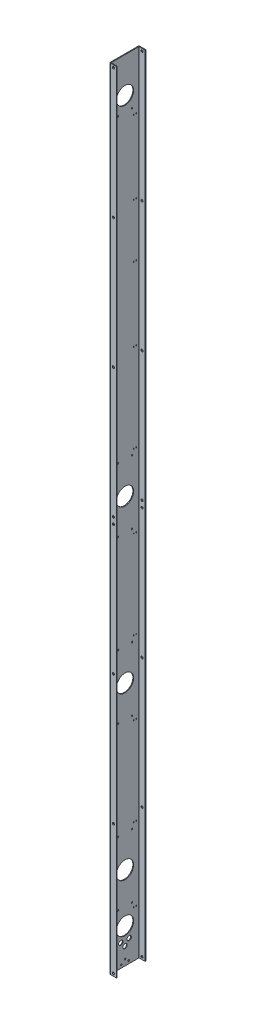
from build123d import *

# Parameters (mm, degrees)
BASE_FLANGE1_DEPTH = 3220
CUT_EXTRUDE1_REACH = 3222.656
SKETCH7_R          = 35
CUT_EXTRUDE3_REACH = 3222.656
SKETCH10_R         = 3
KHE_DAY_RUT_REACH  = 3222.656
SKETCH12_W         = 2
SKETCH12_H         = 5
LPATTERN2_COUNT    = 4
LPATTERN2_PITCH    = 660
LPATTERN3_COUNT    = 2
LPATTERN3_PITCH    = 2500
CUT_EXTRUDE6_REACH = 3229.542
SKETCH14_R         = 4.5
LPATTERN4_COUNT    = 4
LPATTERN4_PITCH    = 529
CUT_EXTRUDE7_REACH = 3222.681
SKETCH16_R         = 9
CUT_EXTRUDE8_REACH = 3222.656
SKETCH17_R         = 3
U_BOLT_REACH       = 3222.656
SKETCH18_R         = 3
LPATTERN6_COUNT    = 3
LPATTERN6_PITCH    = 660


# Sheet-metal steps are written as plain solids
with BuildPart() as part:
    # Sketch2 → Base-Flange1 (new body)
    with BuildSketch(Plane(origin=(0, 0, 0), x_dir=(1, 0, 0), z_dir=(0, 1, 0))):
        with BuildLine():
            Line((185, -57), (161, -57))
            ThreePointArc((161, -57), (160.292893219, -56.707106781), (160, -56))
            Line((160, -56), (160, 56))
            ThreePointArc((160, 56), (160.292893219, 56.707106781), (161, 57))
            Line((161, 57), (185, 57))
            Line((185, 57), (185, 60))
            Line((185, 60), (161, 60))
            ThreePointArc((161, 60), (158.171572875, 58.828427125), (157, 56))
            Line((157, 56), (157, -56))
            ThreePointArc((157, -56), (158.171572875, -58.828427125), (161, -60))
            Line((161, -60), (185, -60))
            Line((185, -60), (185, -57))
        make_face()
    extrude(amount=BASE_FLANGE1_DEPTH)

    # Sketch7 → Cut-Extrude1 (cut, up to next)
    with BuildSketch(Plane(origin=(160, 0, 0), x_dir=(0, 0, -1), z_dir=(1, 0, 0)), mode=Mode.PRIVATE) as cut_extrude1_sk1:
        with Locations((0, 340)):
            Circle(SKETCH7_R)
    cut_extrude1_tool1 = extrude(cut_extrude1_sk1.sketch, amount=-CUT_EXTRUDE1_REACH, mode=Mode.PRIVATE) & part.part
    # Sketch7 → Cut-Extrude1 (cut, up to next)
    with BuildSketch(Plane(origin=(160, 0, 0), x_dir=(0, 0, -1), z_dir=(1, 0, 0)), mode=Mode.PRIVATE) as cut_extrude1_sk2:
        with Locations((0, 1000)):
            Circle(SKETCH7_R)
    cut_extrude1_tool2 = extrude(cut_extrude1_sk2.sketch, amount=-CUT_EXTRUDE1_REACH, mode=Mode.PRIVATE) & part.part
    # Sketch7 → Cut-Extrude1 (cut, up to next)
    with BuildSketch(Plane(origin=(160, 0, 0), x_dir=(0, 0, -1), z_dir=(1, 0, 0)), mode=Mode.PRIVATE) as cut_extrude1_sk3:
        with Locations((0, 1660)):
            Circle(SKETCH7_R)
    cut_extrude1_tool3 = extrude(cut_extrude1_sk3.sketch, amount=-CUT_EXTRUDE1_REACH, mode=Mode.PRIVATE) & part.part
    # Sketch7 → Cut-Extrude1 (cut, up to next)
    with BuildSketch(Plane(origin=(160, 0, 0), x_dir=(0, 0, -1), z_dir=(1, 0, 0)), mode=Mode.PRIVATE) as cut_extrude1_sk4:
        with Locations((0, 3076)):
            Circle(SKETCH7_R)
    cut_extrude1_tool4 = extrude(cut_extrude1_sk4.sketch, amount=-CUT_EXTRUDE1_REACH, mode=Mode.PRIVATE) & part.part
    # Sketch7 → Cut-Extrude1 (cut, up to next)
    with BuildSketch(Plane(origin=(160, 0, 0), x_dir=(0, 0, -1), z_dir=(1, 0, 0)), mode=Mode.PRIVATE) as cut_extrude1_sk5:
        with Locations((0, 142)):
            Circle(SKETCH7_R)
    cut_extrude1_tool5 = extrude(cut_extrude1_sk5.sketch, amount=-CUT_EXTRUDE1_REACH, mode=Mode.PRIVATE) & part.part
    add(cut_extrude1_tool1.solids().sort_by_distance((160, 340, 0))[0], mode=Mode.SUBTRACT)
    add(cut_extrude1_tool2.solids().sort_by_distance((160, 1000, 0))[0], mode=Mode.SUBTRACT)
    add(cut_extrude1_tool3.solids().sort_by_distance((160, 1660, 0))[0], mode=Mode.SUBTRACT)
    add(cut_extrude1_tool4.solids().sort_by_distance((160, 3076, 0))[0], mode=Mode.SUBTRACT)
    add(cut_extrude1_tool5.solids().sort_by_distance((160, 142, 0))[0], mode=Mode.SUBTRACT)

    # Sketch10 → Cut-Extrude3 (cut, up to next)
    with BuildSketch(Plane(origin=(160, 0, 0), x_dir=(0, 0, -1), z_dir=(1, 0, 0)), mode=Mode.PRIVATE) as cut_extrude3_sk1:
        with Locations((-28.5, 3016)):
            Circle(SKETCH10_R)
    cut_extrude3_tool1 = extrude(cut_extrude3_sk1.sketch, amount=-CUT_EXTRUDE3_REACH, mode=Mode.PRIVATE) & part.part
    # Sketch10 → Cut-Extrude3 (cut, up to next)
    with BuildSketch(Plane(origin=(160, 0, 0), x_dir=(0, 0, -1), z_dir=(1, 0, 0)), mode=Mode.PRIVATE) as cut_extrude3_sk2:
        with Locations((28.5, 3016)):
            Circle(SKETCH10_R)
    cut_extrude3_tool2 = extrude(cut_extrude3_sk2.sketch, amount=-CUT_EXTRUDE3_REACH, mode=Mode.PRIVATE) & part.part
    add(cut_extrude3_tool1.solids().sort_by_distance((160, 3016, 28.5))[0], mode=Mode.SUBTRACT)
    add(cut_extrude3_tool2.solids().sort_by_distance((160, 3016, -28.5))[0], mode=Mode.SUBTRACT)

    # Sketch12 → khe day rut (cut, up to next)
    with BuildSketch(Plane(origin=(160, 0, 0), x_dir=(0, 0, -1), z_dir=(1, 0, 0)), mode=Mode.PRIVATE) as khe_day_rut_sk1:
        with Locations((35, 490)):
            Rectangle(SKETCH12_W, SKETCH12_H)
    khe_day_rut_tool1 = extrude(khe_day_rut_sk1.sketch, amount=-KHE_DAY_RUT_REACH, mode=Mode.PRIVATE) & part.part
    # Sketch12 → khe day rut (cut, up to next)
    with BuildSketch(Plane(origin=(160, 0, 0), x_dir=(0, 0, -1), z_dir=(1, 0, 0)), mode=Mode.PRIVATE) as khe_day_rut_sk2:
        with Locations((45, 490)):
            Rectangle(SKETCH12_W, SKETCH12_H)
    khe_day_rut_tool2 = extrude(khe_day_rut_sk2.sketch, amount=-KHE_DAY_RUT_REACH, mode=Mode.PRIVATE) & part.part
    # Sketch12 → khe day rut (cut, up to next)
    with BuildSketch(Plane(origin=(160, 0, 0), x_dir=(0, 0, -1), z_dir=(1, 0, 0)), mode=Mode.PRIVATE) as khe_day_rut_sk3:
        with Locations((-45, 490)):
            Rectangle(SKETCH12_W, SKETCH12_H)
    khe_day_rut_tool3 = extrude(khe_day_rut_sk3.sketch, amount=-KHE_DAY_RUT_REACH, mode=Mode.PRIVATE) & part.part
    # Sketch12 → khe day rut (cut, up to next)
    with BuildSketch(Plane(origin=(160, 0, 0), x_dir=(0, 0, -1), z_dir=(1, 0, 0)), mode=Mode.PRIVATE) as khe_day_rut_sk4:
        with Locations((-35, 490)):
            Rectangle(SKETCH12_W, SKETCH12_H)
    khe_day_rut_tool4 = extrude(khe_day_rut_sk4.sketch, amount=-KHE_DAY_RUT_REACH, mode=Mode.PRIVATE) & part.part
    # Sketch12 → khe day rut (cut, up to next)
    with BuildSketch(Plane(origin=(160, 0, 0), x_dir=(0, 0, -1), z_dir=(1, 0, 0)), mode=Mode.PRIVATE) as khe_day_rut_sk5:
        with Locations((45, 190)):
            Rectangle(SKETCH12_W, SKETCH12_H)
    khe_day_rut_tool5 = extrude(khe_day_rut_sk5.sketch, amount=-KHE_DAY_RUT_REACH, mode=Mode.PRIVATE) & part.part
    # Sketch12 → khe day rut (cut, up to next)
    with BuildSketch(Plane(origin=(160, 0, 0), x_dir=(0, 0, -1), z_dir=(1, 0, 0)), mode=Mode.PRIVATE) as khe_day_rut_sk6:
        with Locations((35, 190)):
            Rectangle(SKETCH12_W, SKETCH12_H)
    khe_day_rut_tool6 = extrude(khe_day_rut_sk6.sketch, amount=-KHE_DAY_RUT_REACH, mode=Mode.PRIVATE) & part.part
    # Sketch12 → khe day rut (cut, up to next)
    with BuildSketch(Plane(origin=(160, 0, 0), x_dir=(0, 0, -1), z_dir=(1, 0, 0)), mode=Mode.PRIVATE) as khe_day_rut_sk7:
        with Locations((-35, 190)):
            Rectangle(SKETCH12_W, SKETCH12_H)
    khe_day_rut_tool7 = extrude(khe_day_rut_sk7.sketch, amount=-KHE_DAY_RUT_REACH, mode=Mode.PRIVATE) & part.part
    # Sketch12 → khe day rut (cut, up to next)
    with BuildSketch(Plane(origin=(160, 0, 0), x_dir=(0, 0, -1), z_dir=(1, 0, 0)), mode=Mode.PRIVATE) as khe_day_rut_sk8:
        with Locations((-45, 190)):
            Rectangle(SKETCH12_W, SKETCH12_H)
    khe_day_rut_tool8 = extrude(khe_day_rut_sk8.sketch, amount=-KHE_DAY_RUT_REACH, mode=Mode.PRIVATE) & part.part
    khe_day_rut_1 = khe_day_rut_tool1.solids().sort_by_distance((160, 490, -35))[0]
    add(khe_day_rut_1, mode=Mode.SUBTRACT)
    khe_day_rut_2 = khe_day_rut_tool2.solids().sort_by_distance((160, 490, -45))[0]
    add(khe_day_rut_2, mode=Mode.SUBTRACT)
    khe_day_rut_3 = khe_day_rut_tool3.solids().sort_by_distance((160, 490, 45))[0]
    add(khe_day_rut_3, mode=Mode.SUBTRACT)
    khe_day_rut_4 = khe_day_rut_tool4.solids().sort_by_distance((160, 490, 35))[0]
    add(khe_day_rut_4, mode=Mode.SUBTRACT)
    khe_day_rut_5 = khe_day_rut_tool5.solids().sort_by_distance((160, 190, -45))[0]
    add(khe_day_rut_5, mode=Mode.SUBTRACT)
    khe_day_rut_6 = khe_day_rut_tool6.solids().sort_by_distance((160, 190, -35))[0]
    add(khe_day_rut_6, mode=Mode.SUBTRACT)
    khe_day_rut_7 = khe_day_rut_tool7.solids().sort_by_distance((160, 190, 35))[0]
    add(khe_day_rut_7, mode=Mode.SUBTRACT)
    khe_day_rut_8 = khe_day_rut_tool8.solids().sort_by_distance((160, 190, 45))[0]
    add(khe_day_rut_8, mode=Mode.SUBTRACT)
    khe_day_rut = khe_day_rut_1 + khe_day_rut_2 + khe_day_rut_3 + khe_day_rut_4 + khe_day_rut_5 + khe_day_rut_6 + khe_day_rut_7 + khe_day_rut_8  # khe day rut as one shape, for the pattern or mirror that repeats it

    # LPattern2: khe day rut ×4
    with Locations(*[(0, i * LPATTERN2_PITCH, 0) for i in range(1, LPATTERN2_COUNT)]):
        add(khe_day_rut, mode=Mode.SUBTRACT)

    # LPattern3: khe day rut ×2
    with Locations(*[(0, i * LPATTERN3_PITCH, 0) for i in range(1, LPATTERN3_COUNT)]):
        add(khe_day_rut, mode=Mode.SUBTRACT)

    # Cut-Extrude6: up to this face of the body (flat: up to its plane)
    cut_extrude6_end = Plane(part.part.faces().sort_by_distance((173, 1610, 60))[0])
    # Sketch14 → Cut-Extrude6 (cut, up to the picked face)
    with BuildSketch(Plane(origin=(0, 0, -60), x_dir=(-1, 0, 0), z_dir=(0, 0, -1)), mode=Mode.PRIVATE) as cut_extrude6_sk1:
        with Locations((-172.5, 10)):
            Circle(SKETCH14_R)
    cut_extrude6_tool1 = split(extrude(cut_extrude6_sk1.sketch, amount=-CUT_EXTRUDE6_REACH, mode=Mode.PRIVATE), bisect_by=cut_extrude6_end, keep=Keep.BOTH, mode=Mode.PRIVATE)
    # Sketch14 → Cut-Extrude6 (cut, up to the picked face)
    with BuildSketch(Plane(origin=(0, 0, -60), x_dir=(-1, 0, 0), z_dir=(0, 0, -1)), mode=Mode.PRIVATE) as cut_extrude6_sk2:
        with Locations((-172.5, 1623)):
            Circle(SKETCH14_R)
    cut_extrude6_tool2 = split(extrude(cut_extrude6_sk2.sketch, amount=-CUT_EXTRUDE6_REACH, mode=Mode.PRIVATE), bisect_by=cut_extrude6_end, keep=Keep.BOTH, mode=Mode.PRIVATE)
    cut_extrude6_1 = cut_extrude6_tool1.solids().sort_by(Axis((172.5, 10, -60), (0, 0, 1)))[0]
    add(cut_extrude6_1, mode=Mode.SUBTRACT)
    cut_extrude6_2 = cut_extrude6_tool2.solids().sort_by(Axis((172.5, 1623, -60), (0, 0, 1)))[0]
    add(cut_extrude6_2, mode=Mode.SUBTRACT)
    cut_extrude6 = cut_extrude6_1 + cut_extrude6_2  # Cut-Extrude6 as one shape, for the pattern or mirror that repeats it

    # LPattern4: Cut-Extrude6 ×4
    with Locations(*[(0, i * LPATTERN4_PITCH, 0) for i in range(1, LPATTERN4_COUNT)]):
        add(cut_extrude6, mode=Mode.SUBTRACT)

    # Sketch16 → Cut-Extrude7 (cut, up to next)
    with BuildSketch(Plane.ZY.offset(-157), mode=Mode.PRIVATE) as cut_extrude7_sk1:
        with Locations((-17.2, 90)):
            Circle(SKETCH16_R)
    cut_extrude7_tool1 = extrude(cut_extrude7_sk1.sketch, amount=-CUT_EXTRUDE7_REACH, mode=Mode.PRIVATE) & part.part
    # Sketch16 → Cut-Extrude7 (cut, up to next)
    with BuildSketch(Plane.ZY.offset(-157), mode=Mode.PRIVATE) as cut_extrude7_sk2:
        with Locations(Location((17.2, 90, 0), (0, 0, 180))):
            Circle(SKETCH16_R)
    cut_extrude7_tool2 = extrude(cut_extrude7_sk2.sketch, amount=-CUT_EXTRUDE7_REACH, mode=Mode.PRIVATE) & part.part
    # Sketch16 → Cut-Extrude7 (cut, up to next)
    with BuildSketch(Plane.ZY.offset(-157), mode=Mode.PRIVATE) as cut_extrude7_sk3:
        with Locations((0, 70)):
            Circle(SKETCH16_R)
    cut_extrude7_tool3 = extrude(cut_extrude7_sk3.sketch, amount=-CUT_EXTRUDE7_REACH, mode=Mode.PRIVATE) & part.part
    add(cut_extrude7_tool1.solids().sort_by_distance((157, 90, -17.2))[0], mode=Mode.SUBTRACT)
    add(cut_extrude7_tool2.solids().sort_by_distance((157, 90, 17.2))[0], mode=Mode.SUBTRACT)
    add(cut_extrude7_tool3.solids().sort_by_distance((157, 70, 0))[0], mode=Mode.SUBTRACT)

    # Sketch17 → Cut-Extrude8 (cut, up to next)
    with BuildSketch(Plane(origin=(160, 0, 0), x_dir=(0, 0, -1), z_dir=(1, 0, 0)), mode=Mode.PRIVATE) as cut_extrude8_sk1:
        with Locations((0, 24)):
            Circle(SKETCH17_R)
    cut_extrude8_tool1 = extrude(cut_extrude8_sk1.sketch, amount=-CUT_EXTRUDE8_REACH, mode=Mode.PRIVATE) & part.part
    # Sketch17 → Cut-Extrude8 (cut, up to next)
    with BuildSketch(Plane(origin=(160, 0, 0), x_dir=(0, 0, -1), z_dir=(1, 0, 0)), mode=Mode.PRIVATE) as cut_extrude8_sk2:
        with Locations((-15, 12)):
            Circle(SKETCH17_R)
    cut_extrude8_tool2 = extrude(cut_extrude8_sk2.sketch, amount=-CUT_EXTRUDE8_REACH, mode=Mode.PRIVATE) & part.part
    # Sketch17 → Cut-Extrude8 (cut, up to next)
    with BuildSketch(Plane(origin=(160, 0, 0), x_dir=(0, 0, -1), z_dir=(1, 0, 0)), mode=Mode.PRIVATE) as cut_extrude8_sk3:
        with Locations((15, 12)):
            Circle(SKETCH17_R)
    cut_extrude8_tool3 = extrude(cut_extrude8_sk3.sketch, amount=-CUT_EXTRUDE8_REACH, mode=Mode.PRIVATE) & part.part
    add(cut_extrude8_tool1.solids().sort_by_distance((160, 24, 0))[0], mode=Mode.SUBTRACT)
    add(cut_extrude8_tool2.solids().sort_by_distance((160, 12, 15))[0], mode=Mode.SUBTRACT)
    add(cut_extrude8_tool3.solids().sort_by_distance((160, 12, -15))[0], mode=Mode.SUBTRACT)

    # Sketch18 → U bolt (cut, up to next)
    with BuildSketch(Plane(origin=(160, 0, 0), x_dir=(0, 0, -1), z_dir=(1, 0, 0)), mode=Mode.PRIVATE) as u_bolt_sk1:
        with Locations((-28.5, 470)):
            Circle(SKETCH18_R)
    u_bolt_tool1 = extrude(u_bolt_sk1.sketch, amount=-U_BOLT_REACH, mode=Mode.PRIVATE) & part.part
    # Sketch18 → U bolt (cut, up to next)
    with BuildSketch(Plane(origin=(160, 0, 0), x_dir=(0, 0, -1), z_dir=(1, 0, 0)), mode=Mode.PRIVATE) as u_bolt_sk2:
        with Locations((28.5, 470)):
            Circle(SKETCH18_R)
    u_bolt_tool2 = extrude(u_bolt_sk2.sketch, amount=-U_BOLT_REACH, mode=Mode.PRIVATE) & part.part
    # Sketch18 → U bolt (cut, up to next)
    with BuildSketch(Plane(origin=(160, 0, 0), x_dir=(0, 0, -1), z_dir=(1, 0, 0)), mode=Mode.PRIVATE) as u_bolt_sk3:
        with Locations((28.5, 210)):
            Circle(SKETCH18_R)
    u_bolt_tool3 = extrude(u_bolt_sk3.sketch, amount=-U_BOLT_REACH, mode=Mode.PRIVATE) & part.part
    # Sketch18 → U bolt (cut, up to next)
    with BuildSketch(Plane(origin=(160, 0, 0), x_dir=(0, 0, -1), z_dir=(1, 0, 0)), mode=Mode.PRIVATE) as u_bolt_sk4:
        with Locations((-28.5, 210)):
            Circle(SKETCH18_R)
    u_bolt_tool4 = extrude(u_bolt_sk4.sketch, amount=-U_BOLT_REACH, mode=Mode.PRIVATE) & part.part
    u_bolt_1 = u_bolt_tool1.solids().sort_by_distance((160, 470, 28.5))[0]
    add(u_bolt_1, mode=Mode.SUBTRACT)
    u_bolt_2 = u_bolt_tool2.solids().sort_by_distance((160, 470, -28.5))[0]
    add(u_bolt_2, mode=Mode.SUBTRACT)
    u_bolt_3 = u_bolt_tool3.solids().sort_by_distance((160, 210, -28.5))[0]
    add(u_bolt_3, mode=Mode.SUBTRACT)
    u_bolt_4 = u_bolt_tool4.solids().sort_by_distance((160, 210, 28.5))[0]
    add(u_bolt_4, mode=Mode.SUBTRACT)
    u_bolt = u_bolt_1 + u_bolt_2 + u_bolt_3 + u_bolt_4  # U bolt as one shape, for the pattern or mirror that repeats it

    # LPattern6: U bolt ×3
    with Locations(*[(0, i * LPATTERN6_PITCH, 0) for i in range(1, LPATTERN6_COUNT)]):
        add(u_bolt, mode=Mode.SUBTRACT)


solid = part.part
